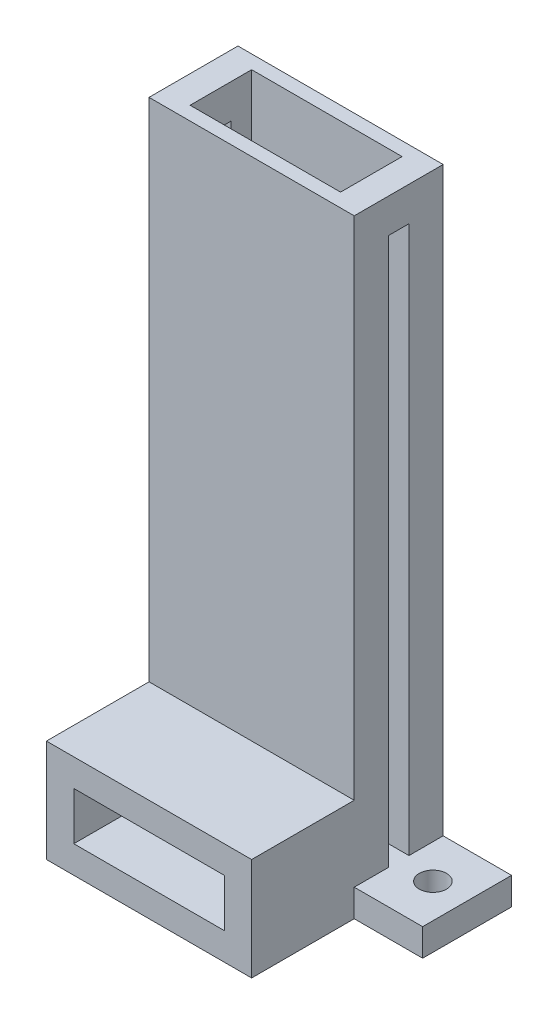
from build123d import *

# Parameters (mm, degrees)
SKETCH1_W           = 30
SKETCH1_H           = 13
BOSS_EXTRUDE1_DEPTH = 85
SKETCH2_W           = 22
SKETCH2_H           = 9
CUT_EXTRUDE2_DEPTH  = 85
SKETCH5_W           = 30
SKETCH5_H           = 13
BOSS_EXTRUDE3_DEPTH = 4
SKETCH12_W          = 22
SKETCH12_H          = 7
CUT_EXTRUDE4_DEPTH  = 13
SKETCH13_W          = 3
SKETCH13_H          = 80
CUT_EXTRUDE5_DEPTH  = 92.07140056
SKETCH14_W          = 30
SKETCH14_H          = 15
BOSS_EXTRUDE4_DEPTH = 15
SKETCH15_W          = 22
SKETCH15_H          = 7
CUT_EXTRUDE6_DEPTH  = 15
SKETCH16_W          = 13
SKETCH16_H          = 4
BOSS_EXTRUDE5_DEPTH = 10
SKETCH18_W          = 13
SKETCH18_H          = 4
BOSS_EXTRUDE6_DEPTH = 10
SKETCH19_R          = 2
CUT_EXTRUDE7_DEPTH  = 10


with BuildPart() as part:
    # Sketch1 → Boss-Extrude1 (new body)
    with BuildSketch(Plane(origin=(0, 0, 0), x_dir=(1, 0, 0), z_dir=(0, 1, 0))):
        with Locations((15, -6.5)):
            Rectangle(SKETCH1_W, SKETCH1_H)
    extrude(amount=BOSS_EXTRUDE1_DEPTH)

    # Sketch2 → Cut-Extrude2 (cut)
    with BuildSketch(Plane(origin=(0, 85, 0), x_dir=(1, 0, 0), z_dir=(0, 1, 0))):
        with Locations((15, -6.5)):
            Rectangle(SKETCH2_W, SKETCH2_H)
    extrude(amount=-CUT_EXTRUDE2_DEPTH, mode=Mode.SUBTRACT)

    # Sketch5 → Boss-Extrude3 (add)
    with BuildSketch(Plane(origin=(0, 0, 0), x_dir=(1, 0, 0), z_dir=(0, 1, 0))):
        with Locations((15, -6.5)):
            Rectangle(SKETCH5_W, SKETCH5_H)
    extrude(amount=-BOSS_EXTRUDE3_DEPTH)

    # Sketch12 → Cut-Extrude4 (cut)
    with BuildSketch(Plane.XY.offset(13)):
        with Locations((15, 3.5)):
            Rectangle(SKETCH12_W, SKETCH12_H)
    extrude(amount=-CUT_EXTRUDE4_DEPTH, mode=Mode.SUBTRACT)

    # Sketch13 → Cut-Extrude5 (cut, through all)
    with BuildSketch(Plane.ZY):
        with Locations((6.5, 40)):
            Rectangle(SKETCH13_W, SKETCH13_H)
    extrude(amount=-CUT_EXTRUDE5_DEPTH, mode=Mode.SUBTRACT)

    # Sketch14 → Boss-Extrude4 (add)
    with BuildSketch(Plane.XY.offset(13)):
        with Locations((15, 3.5)):
            Rectangle(SKETCH14_W, SKETCH14_H)
    extrude(amount=BOSS_EXTRUDE4_DEPTH)

    # Sketch15 → Cut-Extrude6 (cut)
    with BuildSketch(Plane.XY.offset(28)):
        with Locations((15, 3.5)):
            Rectangle(SKETCH15_W, SKETCH15_H)
    extrude(amount=-CUT_EXTRUDE6_DEPTH, mode=Mode.SUBTRACT)

    # Sketch16 → Boss-Extrude5 (add)
    with BuildSketch(Plane.ZY):
        with Locations((6.5, -2)):
            Rectangle(SKETCH16_W, SKETCH16_H)
    extrude(amount=BOSS_EXTRUDE5_DEPTH)

    # Sketch18 → Boss-Extrude6 (add)
    with BuildSketch(Plane(origin=(30, 0, 0), x_dir=(0, 0, -1), z_dir=(1, 0, 0))):
        with Locations((-6.5, -2)):
            Rectangle(SKETCH18_W, SKETCH18_H)
    extrude(amount=BOSS_EXTRUDE6_DEPTH)

    # Sketch19 → Cut-Extrude7 (cut)
    with BuildSketch(Plane(origin=(0, 0, 0), x_dir=(1, 0, 0), z_dir=(0, 1, 0))):
        with Locations((-5, -6.5)):
            Circle(SKETCH19_R)
        with Locations((35, -6.5)):
            Circle(SKETCH19_R)
    extrude(amount=-CUT_EXTRUDE7_DEPTH, mode=Mode.SUBTRACT)


solid = part.part
